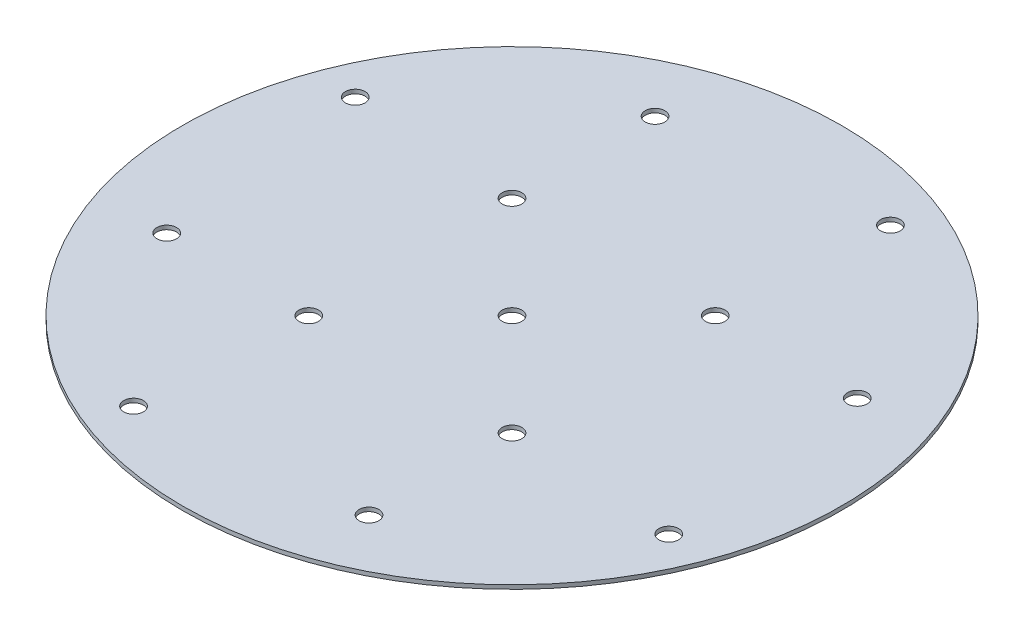
from build123d import *

# Parameters (mm, degrees)
SKETCH2_W                    = 82.55
SKETCH2_H                    = 1
F_10_0_1935_DIAMETER_HOLE1_D = 4.9149
CIRPATTERN3_COUNT            = 4
F_10_0_1935_DIAMETER_HOLE2_D = 4.9149


with BuildPart() as part:
    # Sketch2 → Revolve1 (revolve)
    with BuildSketch(Plane(origin=(0, 0, 0), x_dir=(0, 0, -1), z_dir=(1, 0, 0))):
        with Locations((-41.275, 0.5)):
            Rectangle(SKETCH2_W, SKETCH2_H)
    revolve(axis=Axis((0, -0.05, 0), (0, 1, 0)))

    # #10 (0.1935) Diameter Hole1 (through all)
    with Locations(Plane(origin=(0, 1, 0), x_dir=(1, 0, 0), z_dir=(0, 1, 0))):
        with Locations((-25.333643223, 61.160825052), (264.743675233, 73.787758551), (-67.027460084, 27.763683018), (-25.455844123, 25.455844123)):
            f_10_0_1935_diameter_hole1 = Hole(F_10_0_1935_DIAMETER_HOLE1_D / 2)

    # CirPattern3: #10 (0.1935) Diameter Hole1 ×4 about axis
    cirpattern3_axis = Axis((0, -0.05, 0), (0, 1, 0))
    for i in range(1, CIRPATTERN3_COUNT):
        add(f_10_0_1935_diameter_hole1.rotate(cirpattern3_axis, i * 360 / CIRPATTERN3_COUNT), mode=Mode.SUBTRACT)

    # #10 (0.1935) Diameter Hole2 (through all)
    with Locations(Plane(origin=(0, 1, 0), x_dir=(1, 0, 0), z_dir=(0, 1, 0))):
        with Locations((0, 0)):
            Hole(F_10_0_1935_DIAMETER_HOLE2_D / 2)


solid = part.part
